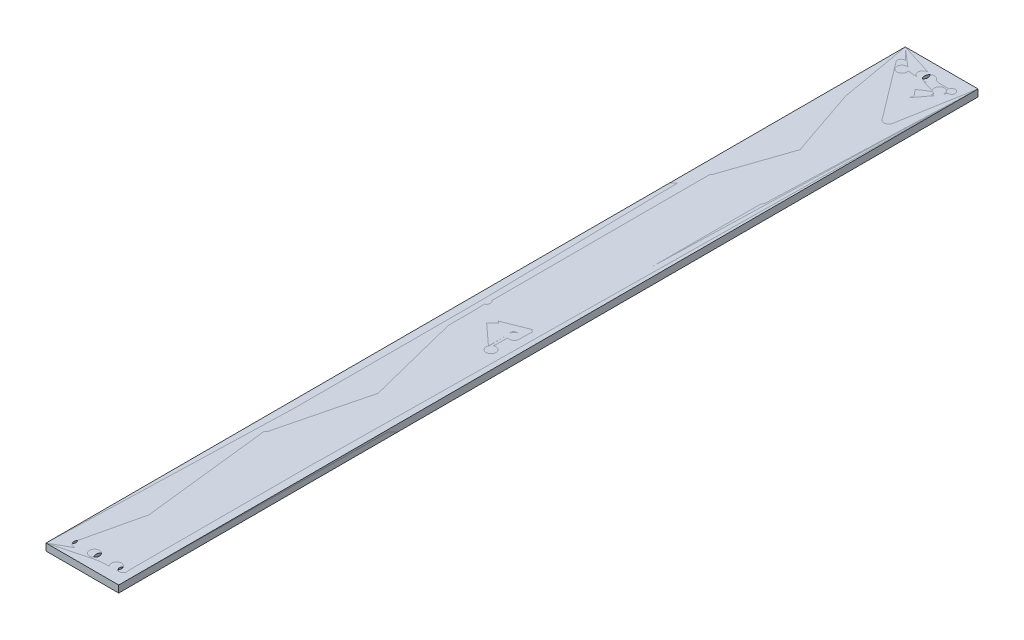
from build123d import *

# Parameters (mm, degrees)
SKETCH1_W             = 33
SKETCH1_H             = 390
BOSS_EXTRUDE1_DEPTH   = 3.175
M4_CLEARANCE_HOLE1_D  = 4.5
M4X0_7_TAPPED_HOLE1_D = 3.3


with BuildPart() as part:
    # Sketch1 → Boss-Extrude1 (new body)
    with BuildSketch(Plane(origin=(0, 0, 0), x_dir=(1, 0, 0), z_dir=(0, 1, 0))):
        Rectangle(SKETCH1_W, SKETCH1_H)
    extrude(amount=BOSS_EXTRUDE1_DEPTH)

    # M4 Clearance Hole1 (through all)
    with Locations(Plane(origin=(0, 3.175, 0), x_dir=(1, 0, 0), z_dir=(0, 1, 0))):
        with Locations((1.5, 188), (-8.5, 185.5), (-8.5, 175.5), (-8.5, 162.5), (-8.5, -7.5), (-8.5, -18), (-8.5, -188), (1.5, -188)):
            Hole(M4_CLEARANCE_HOLE1_D / 2)

    # M4x0.7 Tapped Hole1 (through all)
    with Locations(Plane(origin=(0, 3.175, 0), x_dir=(1, 0, 0), z_dir=(0, 1, 0))):
        with Locations((11.5, 188), (11.5, -188), (11.5, -100), (11.5, 0), (11.5, 102), (11.5, 112)):
            Hole(M4X0_7_TAPPED_HOLE1_D / 2)


with BuildPart() as body_2:
    # Mirror1: mirrored copy
    add(part.part.mirror(Plane(origin=(0, 0, 0), x_dir=(0, 0, 1), z_dir=(1, 0, 0))))


solid = Compound([part.part, body_2.part])
